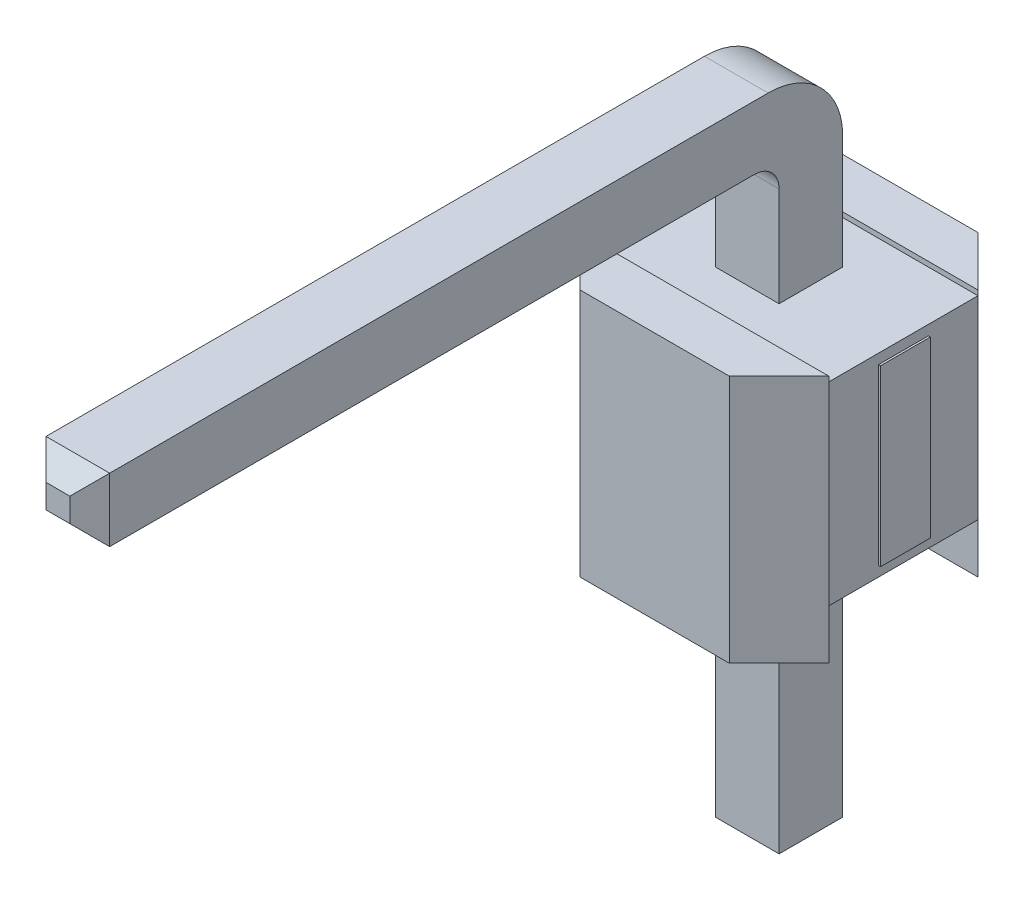
from build123d import *
from OCP.BRepFilletAPI import BRepFilletAPI_MakeFillet

# Parameters (mm, degrees)
BOSS_EXTRUDE1_DEPTH = 0.32
FILLET1_R1          = 0.75
FILLET1_R2          = 0.25
BOSS_EXTRUDE3_DEPTH = 1.25
CHAMFER1_SIZE       = 0.5
SKETCH3_W           = 0.5
SKETCH3_H           = 1.75
BOSS_EXTRUDE4_DEPTH = 1.27
CHAMFER2_SIZE       = 0.2


with BuildPart() as part:
    # Sketch1 → Boss-Extrude1 (new, symmetric)
    with BuildSketch(Plane(origin=(0, 0, 0), x_dir=(0, 0, -1), z_dir=(1, 0, 0))):
        Polygon((-7.25, 2.45), (-0.32, 2.45), (-0.32, -3.79), (0.32, -3.79), (0.32, 3.09), (-7.25, 3.09), align=None)
    extrude(amount=BOSS_EXTRUDE1_DEPTH, both=True)

    # Fillet1: one fillet with a radius per group of edges: ONE call of the kernel's fillet builder (fillet() takes one radius for all edges)
    fillet1_edges_1 = [part.edges().sort_by_distance(p)[0] for p in [
        (0, 3.09, -0.32),
    ]]
    fillet1_edges_2 = [part.edges().sort_by_distance(p)[0] for p in [
        (0, 2.45, 0.32),
    ]]
    fillet1 = BRepFilletAPI_MakeFillet(part.part.solid().wrapped)
    for e in fillet1_edges_1:
        fillet1.Add(FILLET1_R1, e.wrapped)
    for e in fillet1_edges_2:
        fillet1.Add(FILLET1_R2, e.wrapped)
    add(Compound.cast(fillet1.Shape()), mode=Mode.REPLACE)

    # Sketch2 → Boss-Extrude3 (add, symmetric)
    with BuildSketch(Plane(origin=(0, 0, 0), x_dir=(0, -1, 0), z_dir=(1, 0, 0))):
        Polygon((-1.25, 1.25), (1.25, 1.25), (1.25, 0.75), (0.75, 0.75), (0.75, -0.75), (1.25, -0.75), (1.25, -1.25), (-1.25, -1.25), (-1.25, -0.75), (-1.2, -0.75), (-1.2, 0.75), (-1.25, 0.75), align=None)
    extrude(amount=BOSS_EXTRUDE3_DEPTH, both=True)

    # Chamfer1
    chamfer1_edges = [part.edges().sort_by_distance(p)[0] for p in [
        (1.25, 0, 1.25),
        (1.25, 0, -1.25),
        (-1.25, 0, 1.25),
        (-1.25, 0, -1.25),
    ]]
    chamfer(chamfer1_edges, length=CHAMFER1_SIZE - 0.0001)  # a hair under: the kernel refuses the full size

    # Sketch3 → Boss-Extrude4 (add, symmetric)
    with BuildSketch(Plane(origin=(0, 0, 0), x_dir=(0, 0, -1), z_dir=(1, 0, 0))):
        with Locations((0, 0.225)):
            Rectangle(SKETCH3_W, SKETCH3_H)
    extrude(amount=BOSS_EXTRUDE4_DEPTH, both=True)

    # Chamfer2
    chamfer2_edges = [part.edges().sort_by_distance(p)[0] for p in [
        (0, 3.09, 7.25),
        (0, -3.79, -0.32),
        (0, -3.79, 0.32),
        (0, 2.45, 7.25),
        (0.32, -3.79, 0),
        (0.32, 2.77, 7.25),
        (-0.32, -3.79, 0),
        (-0.32, 2.77, 7.25),
    ]]
    chamfer(chamfer2_edges, length=CHAMFER2_SIZE)


solid = part.part
